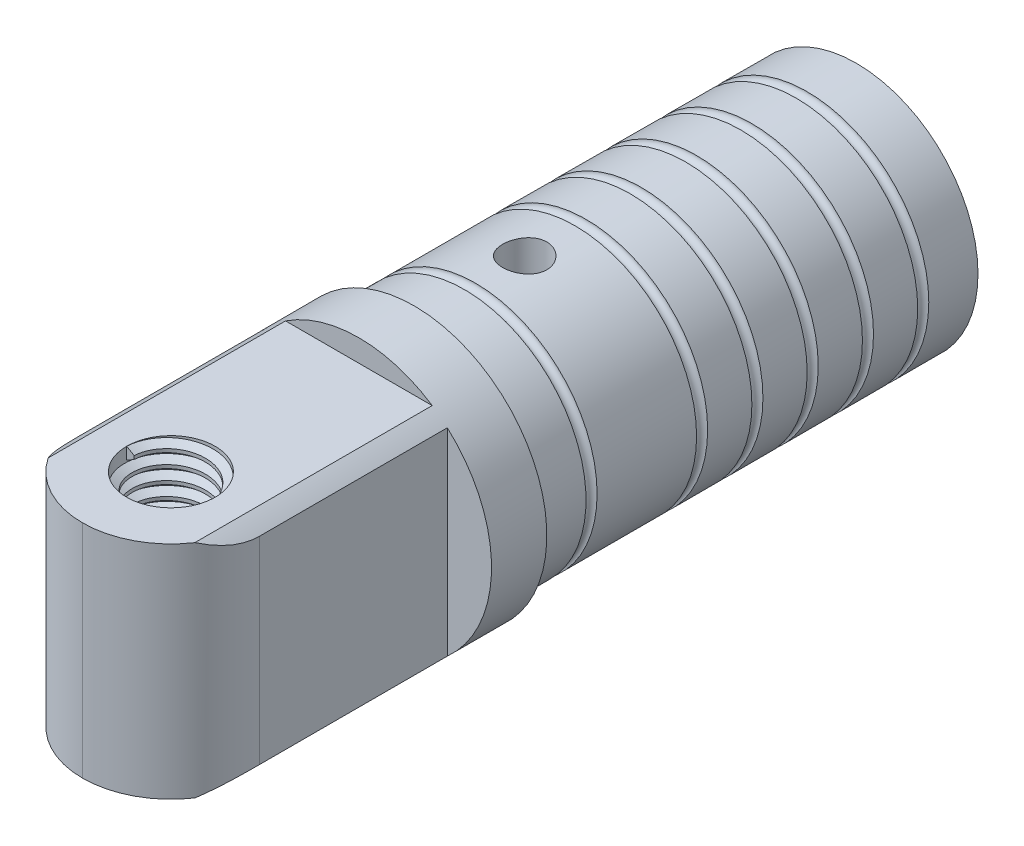
from build123d import *

# Parameters (mm, degrees)
Y_KSEKLIK_EKSTR_ZYON3_DEPTH = 25
IZIM3_R                     = 12
Y_KSEKLIK_EKSTR_ZYON4_DEPTH = 5
IZIM4_R                     = 11
IZIM4_R_2                   = 8
Y_KSEKLIK_EKSTR_ZYON5_DEPTH = 30
FILLET1_R                   = 8
SKETCH1_R                   = 4
CUT_EXTRUDE1_DEPTH          = 31.000000000000004
KES_EKSTR_ZYON2_START       = 100.00000000000003
IZIM6_R                     = 18.11718450959305
IZIM6_R_2                   = 12.000000000000004
KES_EKSTR_ZYON2_DEPTH       = 100.00000000000003
IZIM7_R                     = 11
IZIM7_R_2                   = 8
Y_KSEKLIK_EKSTR_ZYON6_DEPTH = 10
SKETCH2_R                   = 0.5000000000000124
SKETCH2_R_2                 = 0.49999999999999917
CUT_EXTRUDE2_DEPTH          = 13.000000000000002
CUT_EXTRUDE2_DEPTH_BACK     = 13.000000000000002
SKETCH3_R                   = 2
THREAD1_PITCH               = 1.25


with BuildPart() as part:
    # Çizim1 → Yükseklik-Ekstrüzyon3 (new body)
    with BuildSketch(Plane.XY):
        Polygon((8, 10), (-7.999999999999998, 10), (-8, -10), (7.999999999999998, -10), align=None)
    extrude(amount=Y_KSEKLIK_EKSTR_ZYON3_DEPTH)

    # Çizim3 → Yükseklik-Ekstrüzyon4 (add)
    with BuildSketch(Plane(origin=(0, 0, 0), x_dir=(-1, 0, 0), z_dir=(0, 0, -1))):
        with Locations(Location((0, 0, 0), (0, 0, 131.810314896))):
            Circle(IZIM3_R)
    extrude(amount=Y_KSEKLIK_EKSTR_ZYON4_DEPTH)

    # Çizim4 → Yükseklik-Ekstrüzyon5 (add)
    with BuildSketch(Plane(origin=(0, 0, -5), x_dir=(-1, 0, 0), z_dir=(0, 0, -1))):
        Circle(IZIM4_R)
        Circle(IZIM4_R_2, mode=Mode.SUBTRACT)
    extrude(amount=Y_KSEKLIK_EKSTR_ZYON5_DEPTH)

    # Fillet1
    fillet1_edges = [part.edges().sort_by_distance(p)[0] for p in [
        (7.999999999999999, 0, 25),
        (-7.999999999999999, 0, 25),
    ]]
    fillet(fillet1_edges, radius=FILLET1_R - 0.0001)  # a hair under: the kernel refuses the full size

    # Sketch1 → Cut-Extrude1 (cut)
    with BuildSketch(Plane(origin=(0, 10, 0), x_dir=(1, 0, 0), z_dir=(0, 1, 0))):
        with Locations(Location((8.7e-16, -17, 0), (0, 0, 270))):
            Circle(SKETCH1_R)
    extrude(amount=-CUT_EXTRUDE1_DEPTH, mode=Mode.SUBTRACT)

    # Çizim6 → Kes-Ekstrüzyon2 (cut)
    with BuildSketch(Plane.XY.offset(KES_EKSTR_ZYON2_START)):
        Circle(IZIM6_R)
        with Locations(Location((0, 0, 0), (0, 0, 311.810314896))):
            Circle(IZIM6_R_2, mode=Mode.SUBTRACT)
    extrude(amount=-KES_EKSTR_ZYON2_DEPTH, mode=Mode.SUBTRACT)

    # Çizim7 → Yükseklik-Ekstrüzyon6 (add)
    with BuildSketch(Plane(origin=(0, 0, -34.99999999999999), x_dir=(-1, 0, 0), z_dir=(0, 0, -1))):
        Circle(IZIM7_R)
        Circle(IZIM7_R_2, mode=Mode.SUBTRACT)
    extrude(amount=Y_KSEKLIK_EKSTR_ZYON6_DEPTH)

    # Sketch2 → Cut-Revolve1 (revolve, cut)
    with BuildSketch(Plane(origin=(0, 0, 0), x_dir=(1, 0, 0), z_dir=(0, 1, 0))):
        with Locations((-11.00000000000001, 10.048074424960037)):
            Circle(SKETCH2_R)
        with Locations((-11.00000000000001, 20.04807442496004)):
            Circle(SKETCH2_R_2)
        with Locations((-10.999999999999996, 25.04807442496004)):
            Circle(SKETCH2_R_2)
        with Locations((-11.00000000000001, 30.048074424960042)):
            Circle(SKETCH2_R_2)
        with Locations((-11.00000000000001, 35.048074424960035)):
            Circle(SKETCH2_R_2)
        with Locations((-11.00000000000001, 40.048074424960035)):
            Circle(SKETCH2_R_2)
    revolve(axis=Axis((-3.47e-15, 0, -45.04807442496004), (9e-17, 0, 1)), mode=Mode.SUBTRACT)

    # Sketch3 → Cut-Extrude2 (cut, two sides: drawn at the far end of the back side and taken through both)
    with BuildSketch(Plane(origin=(0, 0, 0), x_dir=(1, 0, 0), z_dir=(0, 1, 0)).offset(-CUT_EXTRUDE2_DEPTH_BACK)):
        with Locations(Location((0, 15.000000000000004, 0), (0, 0, 90))):
            Circle(SKETCH3_R)
    extrude(amount=CUT_EXTRUDE2_DEPTH + CUT_EXTRUDE2_DEPTH_BACK, mode=Mode.SUBTRACT)

    # Thread1: the profile of Thread Profile1 profile screwed along a right-hand helix of 16 turns, 8 arcs to a turn; built about Z, then put on its axis
    thread1_z = Axis((0, 0, 0), (0, 0, 1))
    thread1_corners = [(4.0003, 0, -0.000173205), (4.0003, 0, 1.093923202), (3.323417656, 0, 0.703124998), (3.323417656, 0, 0.390624998)]
    with BuildLine(mode=Mode.PRIVATE) as thread1_profile:
        Line(thread1_corners[0], thread1_corners[1])
        Line(thread1_corners[1], thread1_corners[2])
        Line(thread1_corners[2], thread1_corners[3])
        Line(thread1_corners[3], thread1_corners[0])
    thread1_cap = Face(thread1_profile.wire())
    thread1_turn_angles = [0, 22.5, 45, 67.5, 90, 112.5, 135, 157.5, 180, 202.5, 225, 247.5, 270, 292.5, 315, 337.5, 360]
    thread1_turn_weights = [1, 0.9238795325112867, 1, 0.9238795325112867, 1, 0.9238795325112867, 1, 0.9238795325112867, 1, 0.9238795325112867, 1, 0.9238795325112867, 1, 0.9238795325112867, 1, 0.9238795325112867, 1]
    thread1_turn_rails = [Edge.make_bspline([Vector(p[0], p[1], 0).rotate(thread1_z, thread1_turn_angles[k]) / thread1_turn_weights[k] + Vector(0, 0, p[2] + THREAD1_PITCH * thread1_turn_angles[k] / 360) for k in range(17)], [0, 0, 0, 1, 1, 2, 2, 3, 3, 4, 4, 5, 5, 6, 6, 7, 7, 8, 8, 8], 2, thread1_turn_weights) for p in thread1_corners]
    thread1_turn_sides = [Face.make_surface_from_curves(thread1_turn_rails[p[0]], thread1_turn_rails[p[1]]) for p in [(0, 1), (1, 2), (2, 3), (3, 0)]]
    thread1 = Plane(origin=(0, 10, 17), x_dir=(-1, 0, 0), z_dir=(0, -1, 0)) * Solid(Shell([*[p.moved(Location((0, 0, THREAD1_PITCH * i))) for i in range(16) for p in thread1_turn_sides], thread1_cap, thread1_cap.rotate(thread1_z, 5760).moved(Location((0, 0, THREAD1_PITCH * 5760 / 360)))]))
    add(thread1)


solid = part.part
